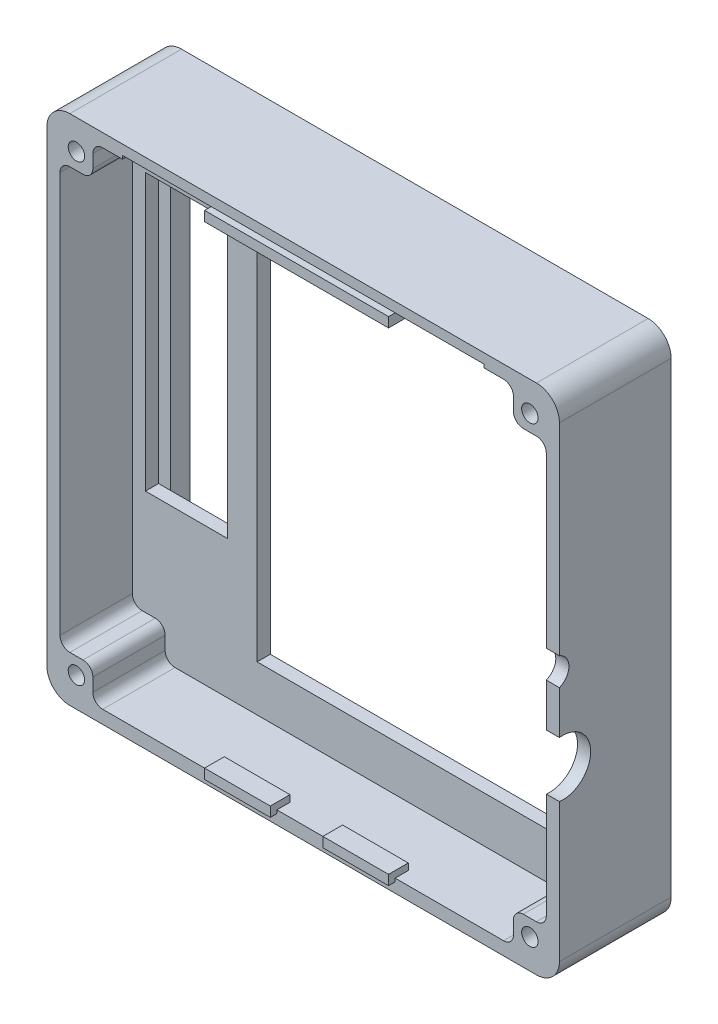
from build123d import *

# Parameters (mm, degrees)
SKETCH_1_W           = 78
SKETCH_1_H           = 78
EXTRUDE_1_DEPTH      = 6
SKETCH_2_W           = 78
SKETCH_2_H           = 78
EXTRUDE_2_DEPTH      = 11
FILLET_1_R           = 1.5
FILLET_2_R           = 3.5
CUT_EXTRUDE_1_DEPTH  = 1
CUT_EXTRUDE_2_DEPTH  = 3
SKETCH_5_R           = 1.25
CUT_EXTRUDE_3_DEPTH  = 58.428216061
SKETCH_6_W           = 55
SKETCH_6_H           = 2
SKETCH_6_W_2         = 54
SKETCH_6_H_2         = 58
SKETCH_6_W_3         = 12.5
SKETCH_6_H_3         = 42
CUT_EXTRUDE_4_DEPTH  = 57.665686266
EXTRUDE_3_DEPTH      = 1
EXTRUDE_3_DEPTH_BACK = 2
SKETCH_7_W           = 10
SKETCH_7_H           = 1.5
SKETCH_7_W_2         = 28
SKETCH_8_R           = 4.25
SKETCH_8_R_2         = 2.247220505
CUT_EXTRUDE_5_DEPTH  = 10


with BuildPart() as part:
    # 草图1 → 凸台-拉伸1 (new body)
    with BuildSketch(Plane.XY):
        Rectangle(SKETCH_1_W, SKETCH_1_H)
    extrude(amount=EXTRUDE_1_DEPTH)

    # 草图2 → 凸台-拉伸2 (add)
    with BuildSketch(Plane.XY.offset(6)):
        Rectangle(SKETCH_2_W, SKETCH_2_H)
        Polygon((-32, 37), (32, 37), (32, 32), (37, 32), (37, -32), (32, -32), (32, -37), (-32, -37), (-32, -32), (-37, -32), (-37, 32), (-32, 32), align=None, mode=Mode.SUBTRACT)
    extrude(amount=EXTRUDE_2_DEPTH)

    # 圆角1
    fillet_1_edges = [part.edges().sort_by_distance(p)[0] for p in [
        (37, 32, 11.5),
        (32, 32, 11.5),
        (32, 37, 11.5),
        (37, -32, 11.5),
        (32, -32, 11.5),
        (32, -37, 11.5),
        (-32, -37, 11.5),
        (-32, -32, 11.5),
        (-37, -32, 11.5),
        (-37, 32, 11.5),
        (-32, 37, 11.5),
        (-32, 32, 11.5),
    ]]
    fillet(fillet_1_edges, radius=FILLET_1_R)

    # 圆角2
    fillet_2_edges = [part.edges().sort_by_distance(p)[0] for p in [
        (-39, 39, 8.5),
        (39, 39, 8.5),
        (39, -39, 8.5),
        (-39, -39, 8.5),
    ]]
    fillet(fillet_2_edges, radius=FILLET_2_R)

    # 草图3 → 切除-拉伸1 (cut)
    with BuildSketch(Plane(origin=(0, 0, 0), x_dir=(-1, 0, 0), z_dir=(0, 0, -1))):
        with BuildLine():
            Line((37.5, -35.5), (37.5, 35.5))
            ThreePointArc((37.5, 35.5), (36.914213562, 36.914213562), (35.5, 37.5))
            Line((35.5, 37.5), (-35.5, 37.5))
            ThreePointArc((-35.5, 37.5), (-36.914213562, 36.914213562), (-37.5, 35.5))
            Line((-37.5, 35.5), (-37.5, -35.5))
            ThreePointArc((-37.5, -35.5), (-36.914213562, -36.914213562), (-35.5, -37.5))
            Line((-35.5, -37.5), (35.5, -37.5))
            ThreePointArc((35.5, -37.5), (36.914213562, -36.914213562), (37.5, -35.5))
        make_face()
    extrude(amount=-CUT_EXTRUDE_1_DEPTH, mode=Mode.SUBTRACT)

    # 草图4 → 切除-拉伸2 (cut)
    with BuildSketch(Plane(origin=(0, 0, 1), x_dir=(-1, 0, 0), z_dir=(0, 0, -1))):
        Polygon((27.5, 37.5), (-27.5, 37.5), (-27.5, 37.1), (-33.2, 37.1), (-33.2, -33.5), (33.2, -33.5), (33.2, 37.1), (27.5, 37.1), align=None)
    extrude(amount=-CUT_EXTRUDE_2_DEPTH, mode=Mode.SUBTRACT)

    # 草图5 → 切除-拉伸3 (cut, through all)
    with BuildSketch(Plane(origin=(0, 0, 1), x_dir=(-1, 0, 0), z_dir=(0, 0, -1))):
        with Locations((-34.5, 34.5)):
            Circle(SKETCH_5_R)
        with Locations((34.5, 34.5)):
            Circle(SKETCH_5_R)
        with Locations((34.5, -34.5)):
            Circle(SKETCH_5_R)
        with Locations((-34.5, -34.5)):
            Circle(SKETCH_5_R)
    extrude(amount=-CUT_EXTRUDE_3_DEPTH, mode=Mode.SUBTRACT)

    # 草图6 → 切除-拉伸4 (cut, through all)
    with BuildSketch(Plane(origin=(0, 0, 4), x_dir=(-1, 0, 0), z_dir=(0, 0, -1))):
        with Locations((0, 36.5)):
            Rectangle(SKETCH_6_W, SKETCH_6_H)
        with Locations((-9, -1)):
            Rectangle(SKETCH_6_W_2, SKETCH_6_H_2)
        with Locations((28.75, 5)):
            Rectangle(SKETCH_6_W_3, SKETCH_6_H_3)
    extrude(amount=-CUT_EXTRUDE_4_DEPTH, mode=Mode.SUBTRACT)

    # 草图7 → 凸台-拉伸3 (add, two sides: drawn at the far end of the back side and taken through both)
    with BuildSketch(Plane.XY.offset(17).offset(-EXTRUDE_3_DEPTH_BACK)):
        with Locations((9, -36.75)):
            Rectangle(SKETCH_7_W, SKETCH_7_H)
        with Locations((-9, -36.75)):
            Rectangle(SKETCH_7_W, SKETCH_7_H)
        with Locations((0, 36.75)):
            Rectangle(SKETCH_7_W_2, SKETCH_7_H)
    extrude(amount=EXTRUDE_3_DEPTH + EXTRUDE_3_DEPTH_BACK)

    # 草图8 → 切除-拉伸5 (cut)
    with BuildSketch(Plane(origin=(39, 0, 0), x_dir=(0, 0, -1), z_dir=(1, 0, 0))):
        with Locations((-16.5, -10.2)):
            Circle(SKETCH_8_R)
        with Locations((-17.8, 2.7)):
            Circle(SKETCH_8_R_2)
    extrude(amount=-CUT_EXTRUDE_5_DEPTH, mode=Mode.SUBTRACT)


solid = part.part
